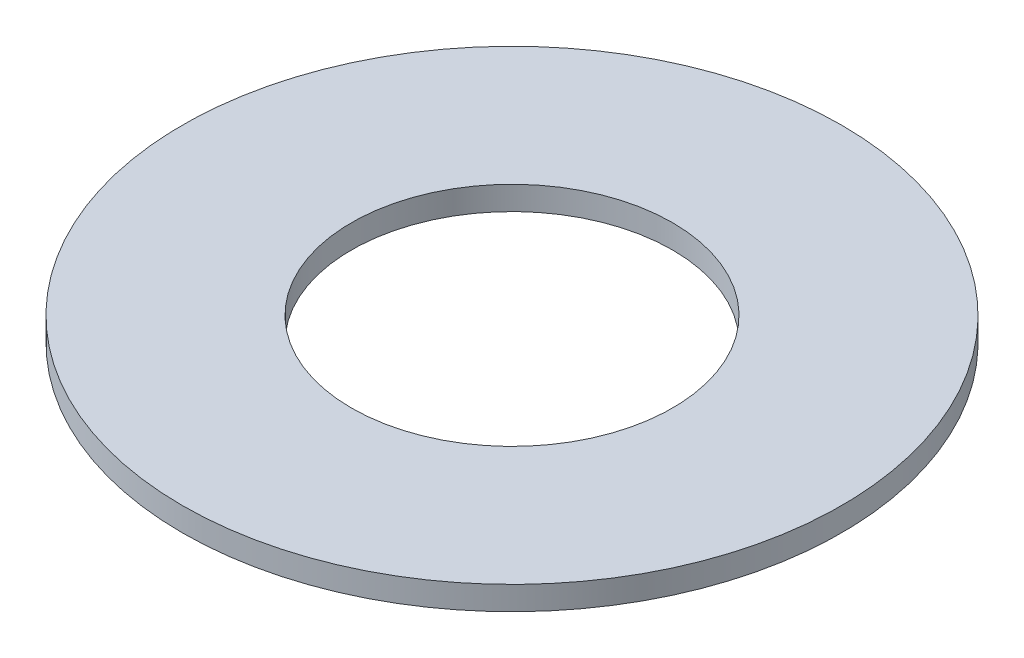
from build123d import *

# Parameters (mm, degrees)
SKETCH1_R           = 97.5
BOSS_EXTRUDE1_DEPTH = 7
SKETCH2_R           = 47.5
CUT_EXTRUDE1_DEPTH  = 139.063391238


with BuildPart() as part:
    # Sketch1 → Boss-Extrude1 (new body)
    with BuildSketch(Plane(origin=(0, 0, 0), x_dir=(1, 0, 0), z_dir=(0, 1, 0))):
        Circle(SKETCH1_R)
    extrude(amount=BOSS_EXTRUDE1_DEPTH)

    # Sketch2 → Cut-Extrude1 (cut, through all)
    with BuildSketch(Plane(origin=(0, 0, 0), x_dir=(1, 0, 0), z_dir=(0, 1, 0))):
        Circle(SKETCH2_R)
    extrude(amount=CUT_EXTRUDE1_DEPTH, mode=Mode.SUBTRACT)


solid = part.part
